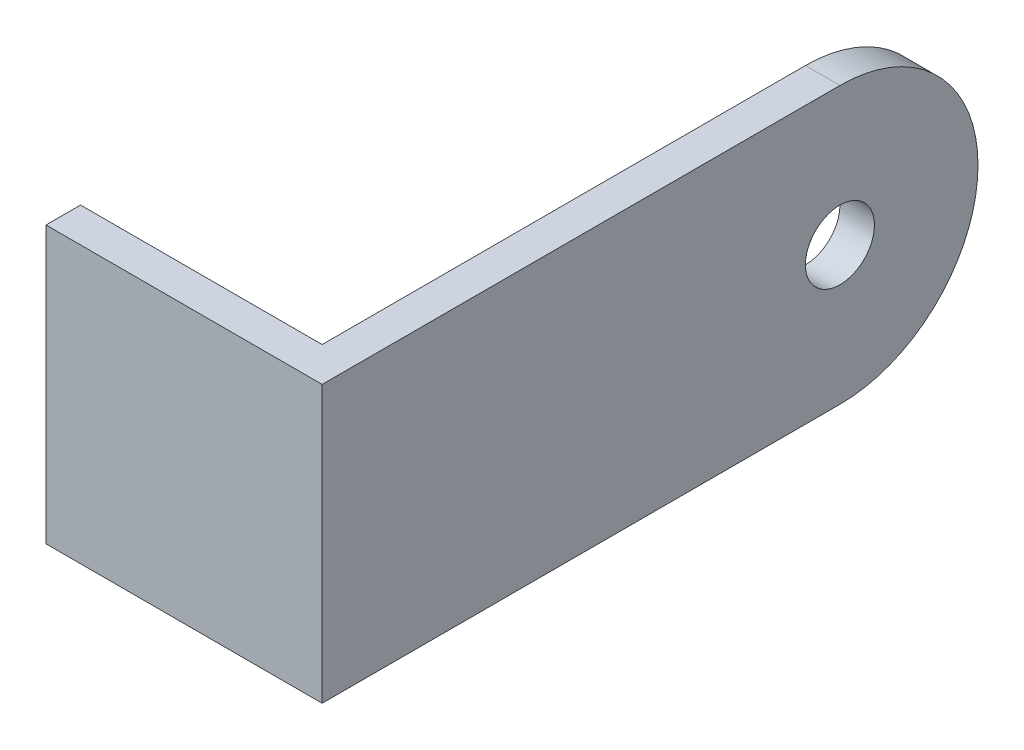
from build123d import *

# Parameters (mm, degrees)
BOSS_EXTRUDE1_DEPTH = 20
SKETCH2_R           = 5
CUT_EXTRUDE1_DEPTH  = 40
FILLET1_R           = 20
FILLET2_R           = 20


with BuildPart() as part:
    # Sketch1 → Boss-Extrude1 (new, symmetric)
    with BuildSketch(Plane(origin=(0, 0, 0), x_dir=(1, 0, 0), z_dir=(0, 1, 0))):
        Polygon((-56.045207575, 13.418938385), (-61.045207575, 13.418938385), (-61.045207575, -76.581061615), (-96.045207575, -76.581061615), (-96.045207575, -81.581061615), (-56.045207575, -81.581061615), align=None)
    extrude(amount=BOSS_EXTRUDE1_DEPTH, both=True)

    # Sketch2 → Cut-Extrude1 (cut)
    with BuildSketch(Plane.ZY.offset(61.045207575)):
        with Locations((6.581061615, 0)):
            Circle(SKETCH2_R)
    extrude(amount=-CUT_EXTRUDE1_DEPTH, mode=Mode.SUBTRACT)

    # Fillet1
    fillet1_edges = [part.edges().sort_by_distance(p)[0] for p in [
        (-58.545207575, 20, -13.418938385),
    ]]
    fillet(fillet1_edges, radius=FILLET1_R)

    # Fillet2
    fillet2_edges = [part.edges().sort_by_distance(p)[0] for p in [
        (-58.545207575, -20, -13.418938385),
    ]]
    fillet(fillet2_edges, radius=FILLET2_R - 0.0001)  # a hair under: the kernel refuses the full size


solid = part.part
